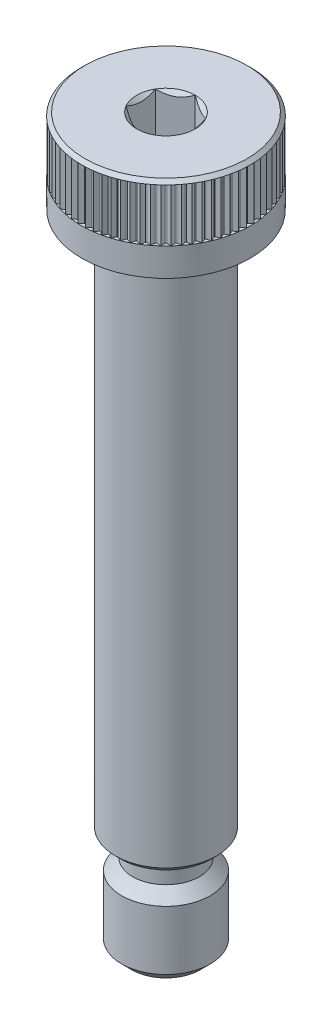
from build123d import *

# Parameters (mm, degrees)
SKETCH1_R          = 3.96875
EXTRUDE1_DEPTH     = 3.96875
CUT_EXTRUDE1_DEPTH = 1.984375
EXTRUDE2_START     = -25.4
EXTRUDE2_OUTLINE_R = 2.38125
EXTRUDE2_DEPTH     = 25.4
SKETCH5_R          = 2.0828
EXTRUDE3_DEPTH     = 4.7625
CHAMFER1_SIZE      = 0.47625
CUT_EXTRUDE3_DEPTH = 2.483971559
CHAMFER2_SIZE      = 0.161862
CIRPATTERN2_COUNT  = 72
FILLET1_R          = 0.396875
CHAMFER3_SIZE      = 0.264583


with BuildPart() as part:
    # Sketch1 → Extrude1 (new body)
    with BuildSketch(Plane(origin=(0, 0, 0), x_dir=(1, 0, 0), z_dir=(0, 1, 0))):
        with Locations(Location((0, 0, 0), (0, 0, 270))):
            Circle(SKETCH1_R)
    extrude(amount=EXTRUDE1_DEPTH)

    # Sketch2 → Cut-Extrude1 (cut)
    with BuildSketch(Plane(origin=(0, 3.96875, 0), x_dir=(-1, 0, 0), z_dir=(0, 1, 0))):
        Polygon((0, -1.374815329), (1.190625, -0.687407664), (1.190625, 0.687407664), (0, 1.374815329), (-1.190625, 0.687407664), (-1.190625, -0.687407664), align=None)
    extrude(amount=-CUT_EXTRUDE1_DEPTH, mode=Mode.SUBTRACT)

    # Extrude2: read off the stored shape, not the designer's step
    # Extrude2 outline → Extrude2 (add)
    with BuildSketch(Plane(origin=(0, 0, 0), x_dir=(1, 0, 0), z_dir=(0, 1, 0)).offset(EXTRUDE2_START)):
        Circle(EXTRUDE2_OUTLINE_R)
    extrude(amount=EXTRUDE2_DEPTH)

    # Sketch5 → Extrude3 (add)
    with BuildSketch(Plane.XZ.offset(25.4)):
        with Locations(Location((0, 0, 0), (0, 0, 90))):
            Circle(SKETCH5_R)
    extrude(amount=EXTRUDE3_DEPTH)

    # Chamfer1: size read off the stored shape
    # Chamfer1
    chamfer1_edges = [part.edges().sort_by_distance(p)[0] for p in [
        (0, -30.1625, -2.0828),
    ]]
    chamfer(chamfer1_edges, length=CHAMFER1_SIZE)

    # Cut-Revolve1: read off the stored shape, not the designer's step
    # Cut-Revolve1 outline → Cut-Revolve1 (revolve, cut)
    with BuildSketch(Plane.XY):
        Polygon((2.0828, -25.4), (1.567244252, -25.4), (1.567244252, -26.3921875), (2.0828, -26.907743248), align=None)
    revolve(axis=Axis((0, 0, 0), (0, 1, 0)), mode=Mode.SUBTRACT)

    # Sketch10 → Cut-Extrude3 (cut)
    with BuildSketch(Plane(origin=(0, 1.322916667, 0), x_dir=(-1, 0, 0), z_dir=(0, 1, 0))):
        with BuildLine():
            Line((-3.964972629, -0.173114444), (-4.023079178, -0.17565143))
            Line((-4.023079178, -0.17565143), (-4.023079178, 0.17565143))
            Line((-4.023079178, 0.17565143), (-3.964972629, 0.173114444))
            Line((-3.964972629, 0.173114444), (-3.817516068, 0.025657883))
            ThreePointArc((-3.817516068, 0.025657883), (-3.806888225, 0), (-3.817516068, -0.025657883))
            Line((-3.817516068, -0.025657883), (-3.964972629, -0.173114444))
        make_face()
    cut_extrude3 = extrude(amount=CUT_EXTRUDE3_DEPTH, mode=Mode.SUBTRACT)

    # Chamfer2: size read off the stored shape
    # Chamfer2
    chamfer2_edges = [part.edges().sort_by_distance(p)[0] for p in [
        (0, 3.96875, -3.96875),
    ]]
    chamfer(chamfer2_edges, length=CHAMFER2_SIZE - 0.0001)  # a hair under: the kernel refuses the full size

    # CirPattern2: Cut-Extrude3 ×72 about axis
    cirpattern2_axis = Axis((0, 0, 0), (0, 1, 0))
    for i in range(1, CIRPATTERN2_COUNT):
        add(cut_extrude3.rotate(cirpattern2_axis, i * 360 / CIRPATTERN2_COUNT), mode=Mode.SUBTRACT)

    # Fillet1
    fillet1_edges = [part.edges().sort_by_distance(p)[0] for p in [
        (-1.567244252, -25.4, 0),
    ]]
    fillet(fillet1_edges, radius=FILLET1_R)

    # Chamfer3: size read off the stored shape
    # Chamfer3
    chamfer3_edges = [part.edges().sort_by_distance(p)[0] for p in [
        (-2.38125, -25.4, 0),
    ]]
    chamfer(chamfer3_edges, length=CHAMFER3_SIZE)

    # Extrude4: read off the stored shape, not the designer's step
    # Extrude4: loft between two sections, ruled curve by curve
    extrude4_from = [
        Edge.make_three_point_arc((0, 3.784410527, -1.190475855), (-0.595237928, 3.784410527, -1.030982333), (-1.030982333, 3.784410527, -0.595237928)),
        Edge.make_line((-1.030982333, 3.784410527, -0.595237928), (0, 3.784410527, -1.190475855)),
    ]
    extrude4_to = [
        Edge.make_three_point_arc((0, 3.968750033, -1.374815362), (-0.687407681, 3.968750033, -1.190625029), (-1.190625029, 3.968750033, -0.687407681)),
        Edge.make_line((-1.190625029, 3.968750033, -0.687407681), (0, 3.968750033, -1.374815362)),
    ]
    extrude4 = Solid(Shell([*[Face.make_surface_from_curves(extrude4_from[k], extrude4_to[k]) for k in range(2)], Face(Wire(extrude4_from)), Face(Wire(extrude4_to))]))
    add(extrude4, mode=Mode.SUBTRACT)

    # Extrude4 2: loft between two sections, ruled curve by curve
    extrude4_2_from = [
        Edge.make_three_point_arc((-1.030981539, 3.784410131, -0.595238512), (-1.190475459, 3.784410131, -4.44e-07), (-1.030981983, 3.784410131, 0.595237743)),
        Edge.make_line((-1.030981983, 3.784410131, 0.595237743), (-1.030981539, 3.784410131, -0.595238512)),
    ]
    extrude4_2_to = [
        Edge.make_three_point_arc((-1.190624478, 3.96875, -0.687408568), (-1.374815329, 3.96875, -5.13e-07), (-1.190624991, 3.96875, 0.68740768)),
        Edge.make_line((-1.190624991, 3.96875, 0.68740768), (-1.190624478, 3.96875, -0.687408568)),
    ]
    extrude4_2 = Solid(Shell([*[Face.make_surface_from_curves(extrude4_2_from[k], extrude4_2_to[k]) for k in range(2)], Face(Wire(extrude4_2_from)), Face(Wire(extrude4_2_to))]))
    add(extrude4_2, mode=Mode.SUBTRACT)

    # Extrude4 3: loft between two sections, ruled curve by curve
    extrude4_3_from = [
        Edge.make_three_point_arc((-1.030982333, 3.784410527, 0.595237928), (-0.595237928, 3.784410527, 1.030982333), (0, 3.784410527, 1.190475855)),
        Edge.make_line((0, 3.784410527, 1.190475855), (-1.030982333, 3.784410527, 0.595237928)),
    ]
    extrude4_3_to = [
        Edge.make_three_point_arc((-1.190625029, 3.968750033, 0.687407681), (-0.687407681, 3.968750033, 1.190625029), (0, 3.968750033, 1.374815362)),
        Edge.make_line((0, 3.968750033, 1.374815362), (-1.190625029, 3.968750033, 0.687407681)),
    ]
    extrude4_3 = Solid(Shell([*[Face.make_surface_from_curves(extrude4_3_from[k], extrude4_3_to[k]) for k in range(2)], Face(Wire(extrude4_3_from)), Face(Wire(extrude4_3_to))]))
    add(extrude4_3, mode=Mode.SUBTRACT)

    # Extrude4 4: loft between two sections, ruled curve by curve
    extrude4_4_from = [
        Edge.make_three_point_arc((0, 3.784410527, 1.190475855), (0.595237928, 3.784410527, 1.030982333), (1.030982333, 3.784410527, 0.595237928)),
        Edge.make_line((1.030982333, 3.784410527, 0.595237928), (0, 3.784410527, 1.190475855)),
    ]
    extrude4_4_to = [
        Edge.make_three_point_arc((0, 3.968750033, 1.374815362), (0.687407681, 3.968750033, 1.190625029), (1.190625029, 3.968750033, 0.687407681)),
        Edge.make_line((1.190625029, 3.968750033, 0.687407681), (0, 3.968750033, 1.374815362)),
    ]
    extrude4_4 = Solid(Shell([*[Face.make_surface_from_curves(extrude4_4_from[k], extrude4_4_to[k]) for k in range(2)], Face(Wire(extrude4_4_from)), Face(Wire(extrude4_4_to))]))
    add(extrude4_4, mode=Mode.SUBTRACT)

    # Extrude4 5: loft between two sections, ruled curve by curve
    extrude4_5_from = [
        Edge.make_three_point_arc((1.030981983, 3.784410131, 0.595237743), (1.190475459, 3.784410131, -4.44e-07), (1.030981539, 3.784410131, -0.595238512)),
        Edge.make_line((1.030981539, 3.784410131, -0.595238512), (1.030981983, 3.784410131, 0.595237743)),
    ]
    extrude4_5_to = [
        Edge.make_three_point_arc((1.190624991, 3.96875, 0.68740768), (1.374815329, 3.96875, -5.13e-07), (1.190624478, 3.96875, -0.687408568)),
        Edge.make_line((1.190624478, 3.96875, -0.687408568), (1.190624991, 3.96875, 0.68740768)),
    ]
    extrude4_5 = Solid(Shell([*[Face.make_surface_from_curves(extrude4_5_from[k], extrude4_5_to[k]) for k in range(2)], Face(Wire(extrude4_5_from)), Face(Wire(extrude4_5_to))]))
    add(extrude4_5, mode=Mode.SUBTRACT)

    # Extrude4 6: loft between two sections, ruled curve by curve
    extrude4_6_from = [
        Edge.make_three_point_arc((1.030982333, 3.784410527, -0.595237928), (0.595237928, 3.784410527, -1.030982333), (0, 3.784410527, -1.190475855)),
        Edge.make_line((0, 3.784410527, -1.190475855), (1.030982333, 3.784410527, -0.595237928)),
    ]
    extrude4_6_to = [
        Edge.make_three_point_arc((1.190625029, 3.968750033, -0.687407681), (0.687407681, 3.968750033, -1.190625029), (0, 3.968750033, -1.374815362)),
        Edge.make_line((0, 3.968750033, -1.374815362), (1.190625029, 3.968750033, -0.687407681)),
    ]
    extrude4_6 = Solid(Shell([*[Face.make_surface_from_curves(extrude4_6_from[k], extrude4_6_to[k]) for k in range(2)], Face(Wire(extrude4_6_from)), Face(Wire(extrude4_6_to))]))
    add(extrude4_6, mode=Mode.SUBTRACT)


solid = part.part
